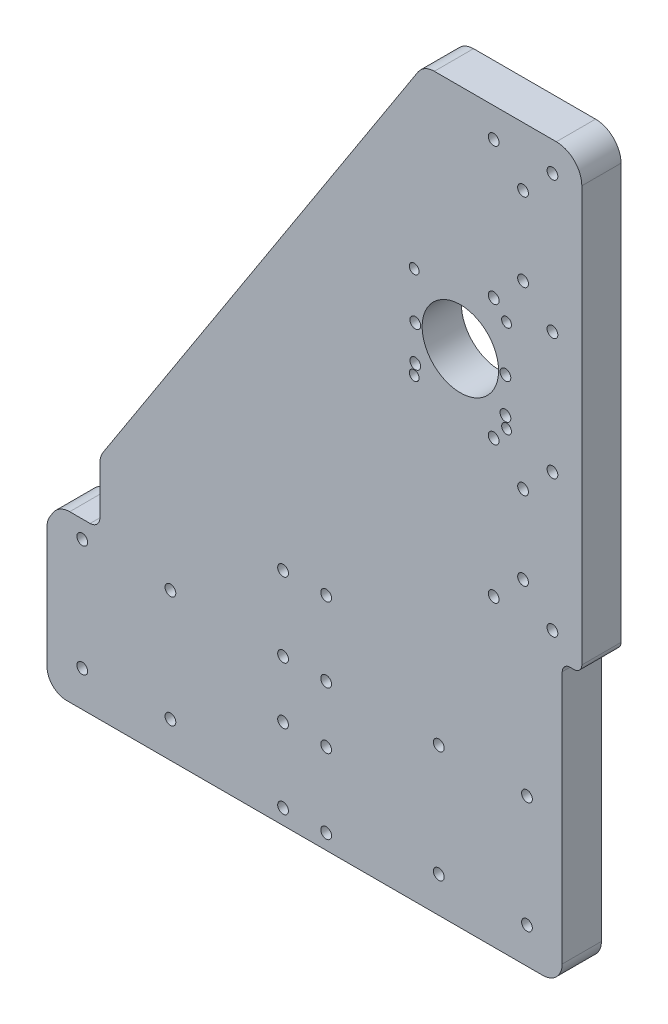
from build123d import *

# Parameters (mm, degrees)
SKETCH2_W               = 270.829085825
SKETCH2_H               = 362
BOSS_EXTRUDE1_DEPTH     = 20
SKETCH3_W               = 7.829085824
SKETCH3_H               = 395.153748613
CUT_EXTRUDE1_DEPTH      = 20
CUT_EXTRUDE2_DEPTH      = 20
FILLET1_R               = 10
M5_CLEARANCE_HOLE1_D    = 5.5
FILLET2_R               = 3
M5_CLEARANCE_HOLE2_D    = 5.5
M5_CLEARANCE_HOLE3_D    = 5.5
SKETCH11_R              = 19.5
CUT_EXTRUDE4_DEPTH      = 32.266788686
CUT_EXTRUDE5_DEPTH      = 20
FILLET3_R               = 10
FILLET4_R               = 5
TAP_DRILL_FOR_M6_TAP1_D = 5
BOSS_EXTRUDE2_DEPTH     = 20


with BuildPart() as part:
    # Sketch2 → Boss-Extrude1 (new body)
    with BuildSketch(Plane.XY.offset(94)):
        with Locations((2322.392578952, 638.909518743)):
            Rectangle(SKETCH2_W, SKETCH2_H)
    extrude(amount=BOSS_EXTRUDE1_DEPTH)

    # Sketch3 → Cut-Extrude1 (cut)
    with BuildSketch(Plane.XY.offset(114)):
        with Locations((2190.892578951, 642.586085608)):
            Rectangle(SKETCH3_W, SKETCH3_H)
    extrude(amount=-CUT_EXTRUDE1_DEPTH, mode=Mode.SUBTRACT)

    # Sketch4 → Cut-Extrude2 (cut)
    with BuildSketch(Plane.XY.offset(114)):
        Polygon((2194.807121863, 532.656963015), (2380.609228318, 819.909518743), (2194.807121863, 819.909518743), align=None)
    extrude(amount=-CUT_EXTRUDE2_DEPTH, mode=Mode.SUBTRACT)

    # Fillet1
    fillet1_edges = [part.edges().sort_by_distance(p)[0] for p in [
        (2457.807121864, 457.909518743, 104),
        (2194.807121863, 457.909518743, 104),
        (2194.807121863, 532.656963015, 104),
        (2380.609228318, 819.909518743, 104),
    ]]
    fillet(fillet1_edges, radius=FILLET1_R)

    # M5 Clearance Hole1 (through all)
    with Locations(Plane.XY.offset(114)):
        with Locations((2212.807121864, 533.160659234), (2257.807121864, 533.160659234), (2257.807121864, 476.160659234), (2212.807121864, 476.160659234), (2439.807121863, 476.160659234), (2394.807121863, 476.160659234), (2394.807121863, 533.160659234), (2439.807121863, 533.160659234), (2315.307121864, 503.660659234), (2337.307121864, 503.660659234), (2315.307121864, 465.660659234), (2337.307121864, 465.660659234), (2337.307121864, 532.660659234), (2315.307121864, 532.660659234), (2315.307121864, 570.660659234), (2337.307121864, 570.660659234)):
            Hole(M5_CLEARANCE_HOLE1_D / 2)

    # Fillet2
    fillet2_edges = [part.edges().sort_by_distance(p)[0] for p in [
        (2457.807121864, 819.909518743, 104),
    ]]
    fillet(fillet2_edges, radius=FILLET2_R)

    # M5 Clearance Hole2 (through all)
    with Locations(Plane.XY.offset(114)):
        with Locations((2422.807121864, 612.909518743), (2437.807121864, 627.909518743), (2452.807121864, 612.909518743), (2452.807121864, 682.909518743), (2437.807121864, 667.909518743), (2422.807121864, 682.909518743), (2452.807121864, 744.909518743), (2422.807121864, 814.909518743), (2452.807121864, 814.909518743), (2422.807121864, 744.909518743), (2437.807121864, 759.909518743), (2437.807121864, 799.909518743)):
            Hole(M5_CLEARANCE_HOLE2_D / 2)

    # M5 Clearance Hole3 (through all)
    with Locations(Plane(origin=(0, 0, 94), x_dir=(-1, 0, 0), z_dir=(0, 0, -1))):
        with Locations((-2428.807121866, 713.909518744), (-2428.807121866, 695.909518744), (-2382.807121866, 695.909518744), (-2382.807121866, 713.909518744)):
            Hole(M5_CLEARANCE_HOLE3_D / 2)

    # Sketch11 → Cut-Extrude4 (cut)
    with BuildSketch(Plane.XY.offset(114)):
        with Locations((2405.807121866, 713.909518744)):
            Circle(SKETCH11_R)
    extrude(amount=-CUT_EXTRUDE4_DEPTH, mode=Mode.SUBTRACT)

    # Sketch12 → Cut-Extrude5 (cut)
    with BuildSketch(Plane.XY.offset(114)):
        Polygon((2221.807121863, 542.160659234), (2195.807121863, 542.160659234), (2221.807121863, 575.660659234), align=None)
    extrude(amount=-CUT_EXTRUDE5_DEPTH, mode=Mode.SUBTRACT)

    # Fillet3
    fillet3_edges = [part.edges().sort_by_distance(p)[0] for p in [
        (2221.807121863, 574.399326181, 104),
        (2200.954349247, 542.160659234, 104),
    ]]
    fillet(fillet3_edges, radius=FILLET3_R)

    # Fillet4
    fillet4_edges = [part.edges().sort_by_distance(p)[0] for p in [
        (2221.807121863, 542.160659234, 104),
    ]]
    fillet(fillet4_edges, radius=FILLET4_R)

    # Tap Drill for M6 Tap1 (through all)
    with Locations(Plane(origin=(0, 0, 94), x_dir=(-1, 0, 0), z_dir=(0, 0, -1))):
        with Locations((-2429.377121866, 737.479518745), (-2382.237121866, 737.479518745), (-2429.377121866, 690.339518745), (-2382.237121866, 690.339518745)):
            Hole(TAP_DRILL_FOR_M6_TAP1_D / 2)

    # Sketch15 → Boss-Extrude2 (add)
    with BuildSketch(Plane.XY.offset(114)):
        with BuildLine():
            Line((2457.807121864, 816.909518743), (2457.807121864, 597.10478226))
            ThreePointArc((2457.807121864, 597.10478226), (2458.978694739, 599.933209385), (2461.807121864, 601.10478226))
            Line((2461.807121864, 601.10478226), (2463.807121864, 601.10478226))
            ThreePointArc((2463.807121864, 601.10478226), (2466.635548988, 602.276355135), (2467.807121864, 605.10478226))
            Line((2467.807121864, 605.10478226), (2467.807121864, 816.909518743))
            ThreePointArc((2467.807121864, 816.909518743), (2463.999510019, 826.101906899), (2454.807121864, 829.909518743))
            Line((2454.807121864, 829.909518743), (2392.518814604, 829.909518743))
            ThreePointArc((2392.518814604, 829.909518743), (2387.739237337, 828.693347131), (2384.122217308, 825.340646974))
            Line((2384.122217308, 825.340646974), (2377.653968279, 815.340646974))
            ThreePointArc((2377.653968279, 815.340646974), (2381.270988308, 818.693347131), (2386.050565575, 819.909518743))
            Line((2386.050565575, 819.909518743), (2454.807121864, 819.909518743))
            ThreePointArc((2454.807121864, 819.909518743), (2456.928442207, 819.030839087), (2457.807121864, 816.909518743))
        make_face()
    extrude(amount=-BOSS_EXTRUDE2_DEPTH)


solid = part.part
